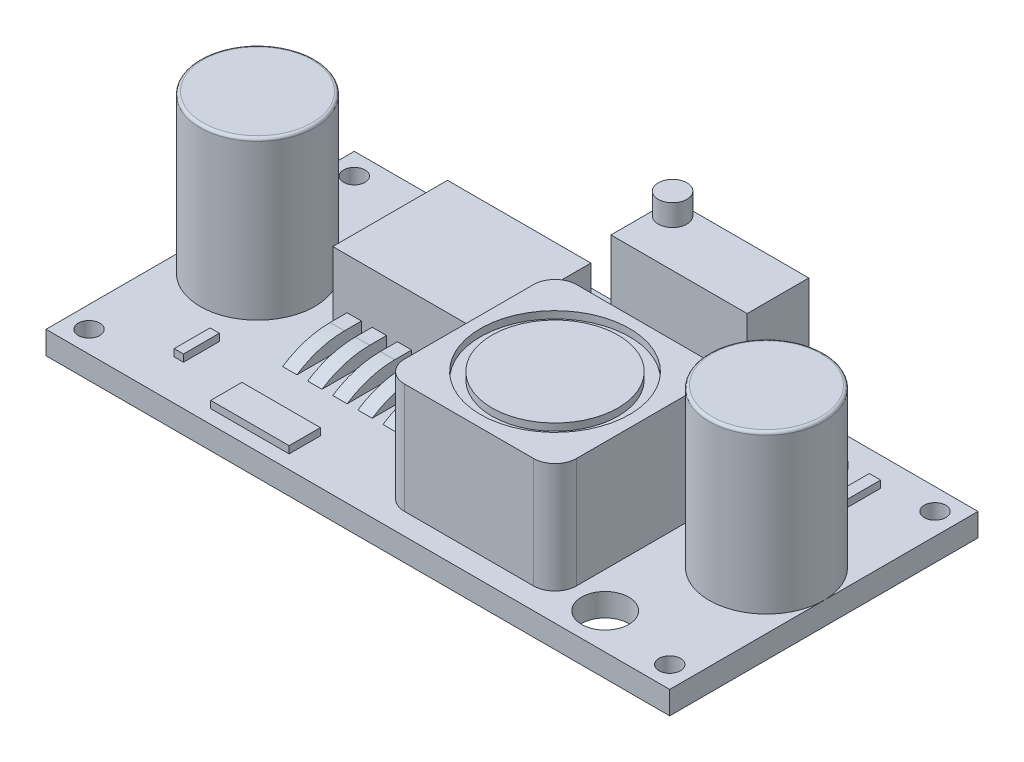
from build123d import *

# Parameters (mm, degrees)
CROQUIS1_W                = 43.5
CROQUIS1_H                = 21.5
SALIENTE_EXTRUIR1_DEPTH   = 1.6
CORTAR_EXTRUIR1_REACH     = 26.314
CROQUIS2_R                = 1.65
CROQUIS2_R_2              = 0.75
CROQUIS3_R                = 4
SALIENTE_EXTRUIR2_DEPTH   = 11
SALIENTE_EXTRUIR2_2_DEPTH = 11
REDONDEO1_R               = 0.2
REDONDEO2_R               = 0.2
SALIENTE_EXTRUIR3_DEPTH   = 7.7
CROQUIS5_R                = 5.2
CROQUIS5_R_2              = 4.4
CORTAR_EXTRUIR2_DEPTH     = 0.5
CROQUIS6_W                = 9.5
CROQUIS6_H                = 4.3
SALIENTE_EXTRUIR4_DEPTH   = 10
CROQUIS7_R                = 1
SALIENTE_EXTRUIR5_DEPTH   = 1.5
CROQUIS8_W                = 10
CROQUIS8_H                = 8
SALIENTE_EXTRUIR6_DEPTH   = 4.5
CROQUIS9_W                = 1
CROQUIS9_H                = 4.5
SALIENTE_EXTRUIR7_DEPTH   = 1
SALIENTE_EXTRUIR7_2_DEPTH = 1
SALIENTE_EXTRUIR7_3_DEPTH = 1
SALIENTE_EXTRUIR7_4_DEPTH = 1
SALIENTE_EXTRUIR7_5_DEPTH = 1
REDONDEO4_R               = 6
REDONDEO5_R               = 6
REDONDEO6_R               = 6
REDONDEO7_R               = 6
REDONDEO8_R               = 6
CROQUIS10_W               = 10
CROQUIS10_H               = 2
SALIENTE_EXTRUIR8_DEPTH   = 1
CROQUIS11_W               = 5.467627337
CROQUIS11_H               = 2.17778377
SALIENTE_EXTRUIR9_DEPTH   = 0.5
CROQUIS11_W_2             = 0.648701548
CROQUIS11_H_2             = 2.502134543
SALIENTE_EXTRUIR9_2_DEPTH = 0.5
CROQUIS11_H_3             = 2.656839028
SALIENTE_EXTRUIR9_3_DEPTH = 0.5
CROQUIS11_H_4             = 2.224119595
SALIENTE_EXTRUIR9_4_DEPTH = 0.5
CROQUIS11_W_3             = 0.926716498
CROQUIS11_H_5             = 3.722563
SALIENTE_EXTRUIR9_5_DEPTH = 0.5
CROQUIS11_W_4             = 0.787709023
SALIENTE_EXTRUIR9_6_DEPTH = 0.5


with BuildPart() as part:
    # Croquis1 → Saliente-Extruir1 (new body)
    with BuildSketch(Plane(origin=(0, 0, 0), x_dir=(1, 0, 0), z_dir=(0, 1, 0))):
        Rectangle(CROQUIS1_W, CROQUIS1_H)
    extrude(amount=-SALIENTE_EXTRUIR1_DEPTH)

    # Croquis2 → Cortar-Extruir1 (cut, up to next)
    with BuildSketch(Plane(origin=(0, 0, 0), x_dir=(1, 0, 0), z_dir=(0, 1, 0)), mode=Mode.PRIVATE) as cortar_extruir1_sk1:
        with Locations(Location((14.75, -8.25, 0), (0, 0, 270))):
            Circle(CROQUIS2_R)
    cortar_extruir1_tool1 = extrude(cortar_extruir1_sk1.sketch, amount=-CORTAR_EXTRUIR1_REACH, mode=Mode.PRIVATE) & part.part
    # Croquis2 → Cortar-Extruir1 (cut, up to next)
    with BuildSketch(Plane(origin=(0, 0, 0), x_dir=(1, 0, 0), z_dir=(0, 1, 0)), mode=Mode.PRIVATE) as cortar_extruir1_sk2:
        with Locations(Location((-14.75, 8.25, 0), (0, 0, 270))):
            Circle(CROQUIS2_R)
    cortar_extruir1_tool2 = extrude(cortar_extruir1_sk2.sketch, amount=-CORTAR_EXTRUIR1_REACH, mode=Mode.PRIVATE) & part.part
    # Croquis2 → Cortar-Extruir1 (cut, up to next)
    with BuildSketch(Plane(origin=(0, 0, 0), x_dir=(1, 0, 0), z_dir=(0, 1, 0)), mode=Mode.PRIVATE) as cortar_extruir1_sk3:
        with Locations(Location((20.25, -9.25, 0), (0, 0, 270))):
            Circle(CROQUIS2_R_2)
    cortar_extruir1_tool3 = extrude(cortar_extruir1_sk3.sketch, amount=-CORTAR_EXTRUIR1_REACH, mode=Mode.PRIVATE) & part.part
    # Croquis2 → Cortar-Extruir1 (cut, up to next)
    with BuildSketch(Plane(origin=(0, 0, 0), x_dir=(1, 0, 0), z_dir=(0, 1, 0)), mode=Mode.PRIVATE) as cortar_extruir1_sk4:
        with Locations(Location((-20.25, -9.25, 0), (0, 0, 270))):
            Circle(CROQUIS2_R_2)
    cortar_extruir1_tool4 = extrude(cortar_extruir1_sk4.sketch, amount=-CORTAR_EXTRUIR1_REACH, mode=Mode.PRIVATE) & part.part
    # Croquis2 → Cortar-Extruir1 (cut, up to next)
    with BuildSketch(Plane(origin=(0, 0, 0), x_dir=(1, 0, 0), z_dir=(0, 1, 0)), mode=Mode.PRIVATE) as cortar_extruir1_sk5:
        with Locations(Location((20.25, 9.25, 0), (0, 0, 270))):
            Circle(CROQUIS2_R_2)
    cortar_extruir1_tool5 = extrude(cortar_extruir1_sk5.sketch, amount=-CORTAR_EXTRUIR1_REACH, mode=Mode.PRIVATE) & part.part
    # Croquis2 → Cortar-Extruir1 (cut, up to next)
    with BuildSketch(Plane(origin=(0, 0, 0), x_dir=(1, 0, 0), z_dir=(0, 1, 0)), mode=Mode.PRIVATE) as cortar_extruir1_sk6:
        with Locations(Location((-20.25, 9.25, 0), (0, 0, 270))):
            Circle(CROQUIS2_R_2)
    cortar_extruir1_tool6 = extrude(cortar_extruir1_sk6.sketch, amount=-CORTAR_EXTRUIR1_REACH, mode=Mode.PRIVATE) & part.part
    add(cortar_extruir1_tool1.solids().sort_by_distance((14.75, 0, 8.25))[0], mode=Mode.SUBTRACT)
    add(cortar_extruir1_tool2.solids().sort_by_distance((-14.75, 0, -8.25))[0], mode=Mode.SUBTRACT)
    add(cortar_extruir1_tool3.solids().sort_by_distance((20.25, 0, 9.25))[0], mode=Mode.SUBTRACT)
    add(cortar_extruir1_tool4.solids().sort_by_distance((-20.25, 0, 9.25))[0], mode=Mode.SUBTRACT)
    add(cortar_extruir1_tool5.solids().sort_by_distance((20.25, 0, -9.25))[0], mode=Mode.SUBTRACT)
    add(cortar_extruir1_tool6.solids().sort_by_distance((-20.25, 0, -9.25))[0], mode=Mode.SUBTRACT)


with BuildPart() as body_2:
    # Croquis3 → Saliente-Extruir2 (new body)
    with BuildSketch(Plane(origin=(0, 0, 0), x_dir=(1, 0, 0), z_dir=(0, 1, 0))):
        with Locations(Location((17.75, 0, 0), (0, 0, 270))):
            Circle(CROQUIS3_R)
    extrude(amount=SALIENTE_EXTRUIR2_DEPTH)

    # Redondeo2
    redondeo2_edges = [body_2.edges().sort_by_distance(p)[0] for p in [
        (17.75, 11, -4),
    ]]
    fillet(redondeo2_edges, radius=REDONDEO2_R)


with BuildPart() as body_3:
    # Croquis3 → Saliente-Extruir2 2 (new body)
    with BuildSketch(Plane(origin=(0, 0, 0), x_dir=(1, 0, 0), z_dir=(0, 1, 0))):
        with Locations(Location((-17.75, 0, 0), (0, 0, 90))):
            Circle(CROQUIS3_R)
    extrude(amount=SALIENTE_EXTRUIR2_2_DEPTH)

    # Redondeo1
    redondeo1_edges = [body_3.edges().sort_by_distance(p)[0] for p in [
        (-17.75, 11, 4),
    ]]
    fillet(redondeo1_edges, radius=REDONDEO1_R)


with BuildPart() as body_4:
    # Croquis4 → Saliente-Extruir3 (new body)
    with BuildSketch(Plane(origin=(0, 0, 0), x_dir=(1, 0, 0), z_dir=(0, 1, 0))):
        with BuildLine():
            Line((1.75, 2.75), (10.75, 2.75))
            ThreePointArc((10.75, 2.75), (11.810660172, 2.310660172), (12.25, 1.25))
            Line((12.25, 1.25), (12.25, -7.75))
            ThreePointArc((12.25, -7.75), (11.810660172, -8.810660172), (10.75, -9.25))
            Line((10.75, -9.25), (1.75, -9.25))
            ThreePointArc((1.75, -9.25), (0.689339828, -8.810660172), (0.25, -7.75))
            Line((0.25, -7.75), (0.25, 1.25))
            ThreePointArc((0.25, 1.25), (0.689339828, 2.310660172), (1.75, 2.75))
        make_face()
    extrude(amount=SALIENTE_EXTRUIR3_DEPTH)

    # Croquis5 → Cortar-Extruir2 (cut)
    with BuildSketch(Plane(origin=(0, 7.7, 0), x_dir=(1, 0, 0), z_dir=(0, 1, 0))):
        with Locations(Location((6.25, -3.25, 0), (0, 0, 270))):
            Circle(CROQUIS5_R)
        with Locations(Location((6.25, -3.25, 0), (0, 0, 270))):
            Circle(CROQUIS5_R_2, mode=Mode.SUBTRACT)
    extrude(amount=-CORTAR_EXTRUIR2_DEPTH, mode=Mode.SUBTRACT)


with BuildPart() as body_5:
    # Croquis6 → Saliente-Extruir4 (new body)
    with BuildSketch(Plane(origin=(0, 0, 0), x_dir=(1, 0, 0), z_dir=(0, 1, 0))):
        with Locations((7, 6.8)):
            Rectangle(CROQUIS6_W, CROQUIS6_H)
    extrude(amount=SALIENTE_EXTRUIR4_DEPTH)


with BuildPart() as body_6:
    # Croquis7 → Saliente-Extruir5 (new body)
    with BuildSketch(Plane(origin=(0, 10, 0), x_dir=(1, 0, 0), z_dir=(0, 1, 0))):
        with Locations(Location((3.25, 7.95, 0), (0, 0, 270))):
            Circle(CROQUIS7_R)
    extrude(amount=SALIENTE_EXTRUIR5_DEPTH)


with BuildPart() as body_7:
    # Croquis8 → Saliente-Extruir6 (new body)
    with BuildSketch(Plane(origin=(0, 0, 0), x_dir=(1, 0, 0), z_dir=(0, 1, 0))):
        with Locations((-7.25, 3.75)):
            Rectangle(CROQUIS8_W, CROQUIS8_H)
    extrude(amount=SALIENTE_EXTRUIR6_DEPTH)


with BuildPart() as body_8:
    # Croquis9 → Saliente-Extruir7 (new body)
    with BuildSketch(Plane(origin=(0, 0, 0), x_dir=(1, 0, 0), z_dir=(0, 1, 0))):
        with Locations((-10.75, -2.5)):
            Rectangle(CROQUIS9_W, CROQUIS9_H)
    extrude(amount=SALIENTE_EXTRUIR7_DEPTH)

    # Redondeo4
    # the kernel refuses this fillet: 6 mm, written as the material it takes off along each edge
    with BuildSketch(Plane(origin=(-1.958438024, 1, 4.75), x_dir=(0, -1.0, -3.316458219143687e-12), z_dir=(-1, 0, 0))) as redondeo4_piece_1:
        with BuildLine():
            CenterArc((6, -3.31662479), REDONDEO4_R, 146.442690238, 33.557309762)
            Line((0, -3.31662479), (-0.12, -3.31662479))
            Line((-0.12, -3.31662479), (-0.12, 0))
            Line((-0.12, 0), (0, 0.12))
            ThreePointArc((0, 0.12), (0.5, 0.12), (0.9, 0.066332496))
            Line((0.9, 0.066332496), (1, 0))
        make_face()
    extrude(amount=17.583123952, mode=Mode.SUBTRACT)


with BuildPart() as body_9:
    # Croquis9 → Saliente-Extruir7 2 (new body)
    with BuildSketch(Plane(origin=(0, 0, 0), x_dir=(1, 0, 0), z_dir=(0, 1, 0))):
        with Locations((-9, -2.5)):
            Rectangle(CROQUIS9_W, CROQUIS9_H)
    extrude(amount=SALIENTE_EXTRUIR7_2_DEPTH)

    # Redondeo5
    # the kernel refuses this fillet: 6 mm, written as the material it takes off along each edge
    with BuildSketch(Plane(origin=(-17.791561976, 1, 4.75), x_dir=(0, -1.0, -3.328892717019364e-12), z_dir=(1, 0, 0))) as redondeo5_piece_1:
        with BuildLine():
            CenterArc((6, 3.31662479), REDONDEO5_R, 180, 33.557309762)
            Line((0, 3.31662479), (-0.12, 3.31662479))
            Line((-0.12, 3.31662479), (-0.12, 0))
            Line((-0.12, 0), (0, -0.12))
            ThreePointArc((0, -0.12), (0.5, -0.12), (0.9, -0.066332496))
            Line((0.9, -0.066332496), (1, 0))
        make_face()
    extrude(amount=17.583123952, mode=Mode.SUBTRACT)


with BuildPart() as body_10:
    # Croquis9 → Saliente-Extruir7 3 (new body)
    with BuildSketch(Plane(origin=(0, 0, 0), x_dir=(1, 0, 0), z_dir=(0, 1, 0))):
        with Locations((-7.25, -2.5)):
            Rectangle(CROQUIS9_W, CROQUIS9_H)
    extrude(amount=SALIENTE_EXTRUIR7_3_DEPTH)

    # Redondeo6
    # the kernel refuses this fillet: 6 mm, written as the material it takes off along each edge
    with BuildSketch(Plane(origin=(-16.041561976, 1, 4.75), x_dir=(0, -1.0, -3.328892717019364e-12), z_dir=(1, 0, 0))) as redondeo6_piece_1:
        with BuildLine():
            CenterArc((6, 3.31662479), REDONDEO6_R, 180, 33.557309762)
            Line((0, 3.31662479), (-0.12, 3.31662479))
            Line((-0.12, 3.31662479), (-0.12, 0))
            Line((-0.12, 0), (0, -0.12))
            ThreePointArc((0, -0.12), (0.5, -0.12), (0.9, -0.066332496))
            Line((0.9, -0.066332496), (1, 0))
        make_face()
    extrude(amount=17.583123952, mode=Mode.SUBTRACT)


with BuildPart() as body_11:
    # Croquis9 → Saliente-Extruir7 4 (new body)
    with BuildSketch(Plane(origin=(0, 0, 0), x_dir=(1, 0, 0), z_dir=(0, 1, 0))):
        with Locations((-5.5, -2.5)):
            Rectangle(CROQUIS9_W, CROQUIS9_H)
    extrude(amount=SALIENTE_EXTRUIR7_4_DEPTH)

    # Redondeo7
    # the kernel refuses this fillet: 6 mm, written as the material it takes off along each edge
    with BuildSketch(Plane(origin=(-14.291561976, 1, 4.75), x_dir=(0, -1.0, -3.316458219143687e-12), z_dir=(1, 0, 0))) as redondeo7_piece_1:
        with BuildLine():
            CenterArc((6, 3.31662479), REDONDEO7_R, 180, 33.557309762)
            Line((0, 3.31662479), (-0.12, 3.31662479))
            Line((-0.12, 3.31662479), (-0.12, 0))
            Line((-0.12, 0), (0, -0.12))
            ThreePointArc((0, -0.12), (0.5, -0.12), (0.9, -0.066332496))
            Line((0.9, -0.066332496), (1, 0))
        make_face()
    extrude(amount=17.583123952, mode=Mode.SUBTRACT)


with BuildPart() as body_12:
    # Croquis9 → Saliente-Extruir7 5 (new body)
    with BuildSketch(Plane(origin=(0, 0, 0), x_dir=(1, 0, 0), z_dir=(0, 1, 0))):
        with Locations((-3.75, -2.5)):
            Rectangle(CROQUIS9_W, CROQUIS9_H)
    extrude(amount=SALIENTE_EXTRUIR7_5_DEPTH)

    # Redondeo8
    # the kernel refuses this fillet: 6 mm, written as the material it takes off along each edge
    with BuildSketch(Plane(origin=(-12.541561976, 1, 4.75), x_dir=(0, -1.0, -3.316458219143687e-12), z_dir=(1, 0, 0))) as redondeo8_piece_1:
        with BuildLine():
            CenterArc((6, 3.31662479), REDONDEO8_R, 180, 33.557309762)
            Line((0, 3.31662479), (-0.12, 3.31662479))
            Line((-0.12, 3.31662479), (-0.12, 0))
            Line((-0.12, 0), (0, -0.12))
            ThreePointArc((0, -0.12), (0.5, -0.12), (0.9, -0.066332496))
            Line((0.9, -0.066332496), (1, 0))
        make_face()
    extrude(amount=17.583123952, mode=Mode.SUBTRACT)


with BuildPart() as body_13:
    # Croquis10 → Saliente-Extruir8 (new body)
    with BuildSketch(Plane(origin=(0, 0, 0), x_dir=(1, 0, 0), z_dir=(0, 1, 0))):
        with Locations((-7.25, 8.75)):
            Rectangle(CROQUIS10_W, CROQUIS10_H)
    extrude(amount=SALIENTE_EXTRUIR8_DEPTH)


with BuildPart() as body_14:
    # Croquis11 → Saliente-Extruir9 (new body)
    with BuildSketch(Plane(origin=(0, 0, 0), x_dir=(1, 0, 0), z_dir=(0, 1, 0))):
        with Locations((-8.479455954, -8.711135078)):
            Rectangle(CROQUIS11_W, CROQUIS11_H)
    extrude(amount=SALIENTE_EXTRUIR9_DEPTH)


with BuildPart() as body_15:
    # Croquis11 → Saliente-Extruir9 2 (new body)
    with BuildSketch(Plane(origin=(0, 0, 0), x_dir=(1, 0, 0), z_dir=(0, 1, 0))):
        with Locations((-15.290822211, -6.695526695)):
            Rectangle(CROQUIS11_W_2, CROQUIS11_H_2)
    extrude(amount=SALIENTE_EXTRUIR9_2_DEPTH)


with BuildPart() as body_16:
    # Croquis11 → Saliente-Extruir9 3 (new body)
    with BuildSketch(Plane(origin=(0, 0, 0), x_dir=(1, 0, 0), z_dir=(0, 1, 0))):
        with Locations((-0.324350774, 7.421580486)):
            Rectangle(CROQUIS11_W_2, CROQUIS11_H_3)
    extrude(amount=SALIENTE_EXTRUIR9_3_DEPTH)


with BuildPart() as body_17:
    # Croquis11 → Saliente-Extruir9 4 (new body)
    with BuildSketch(Plane(origin=(0, 0, 0), x_dir=(1, 0, 0), z_dir=(0, 1, 0))):
        with Locations((-0.324350774, 3.915377203)):
            Rectangle(CROQUIS11_W_2, CROQUIS11_H_4)
    extrude(amount=SALIENTE_EXTRUIR9_4_DEPTH)


with BuildPart() as body_18:
    # Croquis11 → Saliente-Extruir9 5 (new body)
    with BuildSketch(Plane(origin=(0, 0, 0), x_dir=(1, 0, 0), z_dir=(0, 1, 0))):
        with Locations((14.225098239, 6.8887185)):
            Rectangle(CROQUIS11_W_3, CROQUIS11_H_5)
    extrude(amount=SALIENTE_EXTRUIR9_5_DEPTH)


with BuildPart() as body_19:
    # Croquis11 → Saliente-Extruir9 6 (new body)
    with BuildSketch(Plane(origin=(0, 0, 0), x_dir=(1, 0, 0), z_dir=(0, 1, 0))):
        with Locations((16.565057395, 6.8887185)):
            Rectangle(CROQUIS11_W_4, CROQUIS11_H_5)
    extrude(amount=SALIENTE_EXTRUIR9_6_DEPTH)


solid = Compound([part.part, body_2.part, body_3.part, body_4.part, body_5.part, body_6.part, body_7.part, body_8.part, body_9.part, body_10.part, body_11.part, body_12.part, body_13.part, body_14.part, body_15.part, body_16.part, body_17.part, body_18.part, body_19.part])
